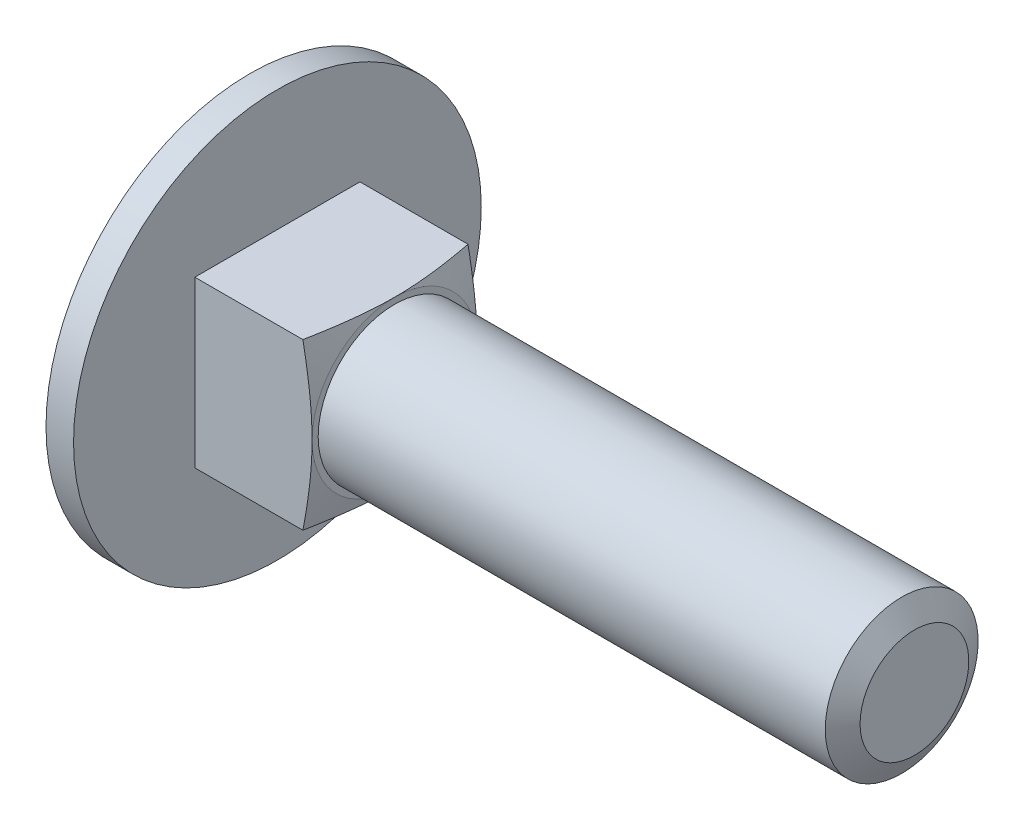
from build123d import *

# Parameters (mm, degrees)
CUT_REVOLVE_1_2_OUTLINE_W = 6.48
CUT_REVOLVE_1_2_OUTLINE_H = 6.48
CUT_REVOLVE_1_2_DEPTH     = 4.6


with BuildPart() as part:
    # 草图1 → Revolve 699 (revolve)
    with BuildSketch(Plane.XY):
        with BuildLine():
            Line((-1.081081081, 8), (0, 8))
            Line((0, 8), (0, 0))
            Line((0, 0), (-3.6, 0))
            ThreePointArc((-3.6, 0), (-2.955391275, 4.193594893), (-1.081081081, 8))
        make_face()
    revolve(axis=Axis((-3.6, 0, 0), (1, 0, 0)))



with BuildPart() as body_2:
    # 切除-旋转1: read off the stored shape, not the designer's step
    # 切除-旋转1 outline → 切除-旋转1 (revolve)
    with BuildSketch(Plane.YX):
        Polygon((3, 24.500014667), (2.134, 25), (0, 25), (0, 4.240398306), (3, 4.240398306), align=None)
    revolve(axis=Axis((0, 0, 0), (1, 0, 0)))


with BuildPart() as part_1:
    add(part.part)

    add(body_2.part)  # Cut-Revolve 1 2 merges body 2
    # Cut-Revolve 1 2 outline → Cut-Revolve 1 2 (add)
    with BuildSketch(Plane.YZ):
        Rectangle(CUT_REVOLVE_1_2_OUTLINE_W, CUT_REVOLVE_1_2_OUTLINE_H)
    extrude(amount=CUT_REVOLVE_1_2_DEPTH)

    # Cut-Revolve 1 3 outline → Cut-Revolve 1 3 (revolve, cut)
    with BuildSketch(Plane.YX):
        Polygon((4.582051794, 4.6), (3.24, 4.6), (4.582051794, 4.240398306), align=None)
    revolve(axis=Axis((0, 0, 0), (1, 0, 0)), mode=Mode.SUBTRACT)


solid = part_1.part
